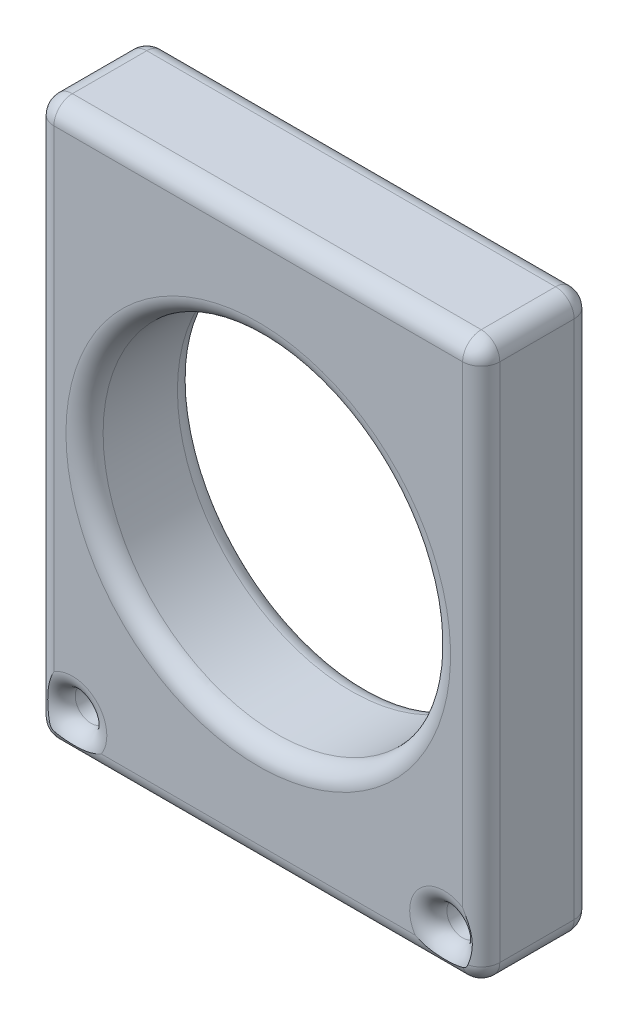
from build123d import *

# Parameters (mm, degrees)
SKETCH_1_W      = 48
SKETCH_1_H      = 60
SKETCH_1_R      = 18.7
SKETCH_1_R_2    = 1.7
EXTRUDE_1_DEPTH = 6
FILLET_1_R      = 2


with BuildPart() as part:
    # 草图1 → 凸台-拉伸1 (new, symmetric)
    with BuildSketch(Plane.XY):
        with Locations((0, 6)):
            Rectangle(SKETCH_1_W, SKETCH_1_H)
        with Locations((0, 6)):
            Circle(SKETCH_1_R, mode=Mode.SUBTRACT)
        with Locations((20, -20)):
            Circle(SKETCH_1_R_2, mode=Mode.SUBTRACT)
        with Locations((-20, -20)):
            Circle(SKETCH_1_R_2, mode=Mode.SUBTRACT)
    extrude(amount=EXTRUDE_1_DEPTH, both=True)

    # 圆角1
    # the kernel refuses this fillet: 2 mm, written as the material it takes off along each edge
    with BuildSketch(Plane(origin=(-22, 34, 4), x_dir=(0, 1, 0), z_dir=(-1, 0, 0))) as fillet_1_piece_1_section:
        Polygon((0, 0), (FILLET_1_R, 0), (FILLET_1_R, -FILLET_1_R), (0, -FILLET_1_R), align=None)
    fillet_1_piece_1 = extrude(amount=FILLET_1_R, mode=Mode.PRIVATE)
    fillet_1_piece_1 = fillet_1_piece_1 - Plane(origin=(-22, 34, 4), x_dir=(0, -0.7071067811865475, -0.7071067811865475), z_dir=(-1, 0, 0)) * Sphere(FILLET_1_R, mode=Mode.PRIVATE)
    add(fillet_1_piece_1, mode=Mode.SUBTRACT)
    with BuildSketch(Plane(origin=(-22, -22, 4), x_dir=(-1, 0, 0), z_dir=(0, -1, 0))) as fillet_1_piece_2_section:
        Polygon((0, 0), (FILLET_1_R, 0), (FILLET_1_R, -FILLET_1_R), (0, -FILLET_1_R), align=None)
    fillet_1_piece_2 = extrude(amount=FILLET_1_R, mode=Mode.PRIVATE)
    fillet_1_piece_2 = fillet_1_piece_2 - Plane(origin=(-22, -22, 4), x_dir=(0.7071067811865475, 0, -0.7071067811865475), z_dir=(0, -1, 0)) * Sphere(FILLET_1_R, mode=Mode.PRIVATE)
    add(fillet_1_piece_2, mode=Mode.SUBTRACT)
    with BuildSketch(Plane(origin=(22, -22, 4), x_dir=(0, 0, 1), z_dir=(0, -1, 0))) as fillet_1_piece_3_section:
        Polygon((0, 0), (FILLET_1_R, 0), (FILLET_1_R, -FILLET_1_R), (0, -FILLET_1_R), align=None)
    fillet_1_piece_3 = extrude(amount=FILLET_1_R, mode=Mode.PRIVATE)
    fillet_1_piece_3 = fillet_1_piece_3 - Plane(origin=(22, -22, 4), x_dir=(-0.7071067811865475, 0, -0.7071067811865475), z_dir=(0, -1, 0)) * Sphere(FILLET_1_R, mode=Mode.PRIVATE)
    add(fillet_1_piece_3, mode=Mode.SUBTRACT)
    with BuildSketch(Plane(origin=(22, 34, 4), x_dir=(0, 0, 1), z_dir=(0, 1, 0))) as fillet_1_piece_4_section:
        Polygon((0, 0), (FILLET_1_R, 0), (FILLET_1_R, FILLET_1_R), (0, FILLET_1_R), align=None)
    fillet_1_piece_4 = extrude(amount=FILLET_1_R, mode=Mode.PRIVATE)
    fillet_1_piece_4 = fillet_1_piece_4 - Plane(origin=(22, 34, 4), x_dir=(-0.7071067811865475, 0, -0.7071067811865475), z_dir=(0, 1, 0)) * Sphere(FILLET_1_R, mode=Mode.PRIVATE)
    add(fillet_1_piece_4, mode=Mode.SUBTRACT)
    with BuildSketch(Plane(origin=(-22, -22, -4), x_dir=(0, 0, -1), z_dir=(0, -1, 0))) as fillet_1_piece_5_section:
        Polygon((0, 0), (FILLET_1_R, 0), (FILLET_1_R, -FILLET_1_R), (0, -FILLET_1_R), align=None)
    fillet_1_piece_5 = extrude(amount=FILLET_1_R, mode=Mode.PRIVATE)
    fillet_1_piece_5 = fillet_1_piece_5 - Plane(origin=(-22, -22, -4), x_dir=(0.7071067811865475, 0, 0.7071067811865475), z_dir=(0, -1, 0)) * Sphere(FILLET_1_R, mode=Mode.PRIVATE)
    add(fillet_1_piece_5, mode=Mode.SUBTRACT)
    with BuildSketch(Plane(origin=(22, -22, -4), x_dir=(0, 0, -1), z_dir=(0, -1, 0))) as fillet_1_piece_6_section:
        Polygon((0, 0), (FILLET_1_R, 0), (FILLET_1_R, FILLET_1_R), (0, FILLET_1_R), align=None)
    fillet_1_piece_6 = extrude(amount=FILLET_1_R, mode=Mode.PRIVATE)
    fillet_1_piece_6 = fillet_1_piece_6 - Plane(origin=(22, -22, -4), x_dir=(-0.7071067811865475, 0, 0.7071067811865475), z_dir=(0, -1, 0)) * Sphere(FILLET_1_R, mode=Mode.PRIVATE)
    add(fillet_1_piece_6, mode=Mode.SUBTRACT)
    with BuildSketch(Plane(origin=(-22, 34, -4), x_dir=(-1, 0, 0), z_dir=(0, 0, -1))) as fillet_1_piece_7_section:
        Polygon((0, 0), (FILLET_1_R, 0), (FILLET_1_R, FILLET_1_R), (0, FILLET_1_R), align=None)
    fillet_1_piece_7 = extrude(amount=FILLET_1_R, mode=Mode.PRIVATE)
    fillet_1_piece_7 = fillet_1_piece_7 - Plane(origin=(-22, 34, -4), x_dir=(0.7071067811865475, -0.7071067811865475, 0), z_dir=(0, 0, -1)) * Sphere(FILLET_1_R, mode=Mode.PRIVATE)
    add(fillet_1_piece_7, mode=Mode.SUBTRACT)
    with BuildSketch(Plane(origin=(22, 34, -4), x_dir=(0, 1, 0), z_dir=(0, 0, -1))) as fillet_1_piece_8_section:
        Polygon((0, 0), (FILLET_1_R, 0), (FILLET_1_R, FILLET_1_R), (0, FILLET_1_R), align=None)
    fillet_1_piece_8 = extrude(amount=FILLET_1_R, mode=Mode.PRIVATE)
    fillet_1_piece_8 = fillet_1_piece_8 - Plane(origin=(22, 34, -4), x_dir=(-0.7071067811865475, -0.7071067811865475, 0), z_dir=(0, 0, -1)) * Sphere(FILLET_1_R, mode=Mode.PRIVATE)
    add(fillet_1_piece_8, mode=Mode.SUBTRACT)
    with BuildSketch(Plane(origin=(0, 6, -6), x_dir=(1, 0, 0), z_dir=(0, -1, 0))) as fillet_1_piece_9:
        with BuildLine():
            CenterArc((18.7 + FILLET_1_R, FILLET_1_R), FILLET_1_R, 180, 90)
            Line((18.7 + FILLET_1_R, 0), (18.7, 0))
            Line((18.7, 0), (18.7, FILLET_1_R))
        make_face()
    revolve(axis=Axis((0, 6, -6), (0, 0, 1)), mode=Mode.SUBTRACT)
    with BuildSketch(Plane(origin=(0, 6, 6), x_dir=(1, 0, 0), z_dir=(0, -1, 0))) as fillet_1_piece_10:
        with BuildLine():
            CenterArc((18.7 + FILLET_1_R, -FILLET_1_R), FILLET_1_R, 90, 90)
            Line((18.7, -FILLET_1_R), (18.7, 0))
            Line((18.7, 0), (18.7 + FILLET_1_R, 0))
        make_face()
    revolve(axis=Axis((0, 6, 6), (0, 0, 1)), mode=Mode.SUBTRACT)
    with BuildSketch(Plane(origin=(-24, 34, 6), x_dir=(0, 0, -1), z_dir=(0, -1, 0))) as fillet_1_piece_11:
        with BuildLine():
            CenterArc((FILLET_1_R, FILLET_1_R), FILLET_1_R, 180, 90)
            Line((0, FILLET_1_R), (0, 0))
            Line((0, 0), (FILLET_1_R, 0))
        make_face()
    extrude(amount=56, mode=Mode.SUBTRACT)
    with BuildSketch(Plane(origin=(20, -20, -6), x_dir=(1, 0, 0), z_dir=(0, -1, 0))) as fillet_1_piece_12:
        with BuildLine():
            CenterArc((1.7 + FILLET_1_R, FILLET_1_R), FILLET_1_R, 180, 90)
            Line((1.7 + FILLET_1_R, 0), (1.7, 0))
            Line((1.7, 0), (1.7, FILLET_1_R))
        make_face()
    revolve(axis=Axis((20, -20, -6), (0, 0, 1)), mode=Mode.SUBTRACT)
    with BuildSketch(Plane(origin=(20, -20, 6), x_dir=(1, 0, 0), z_dir=(0, -1, 0))) as fillet_1_piece_13:
        with BuildLine():
            CenterArc((1.7 + FILLET_1_R, -FILLET_1_R), FILLET_1_R, 90, 90)
            Line((1.7, -FILLET_1_R), (1.7, 0))
            Line((1.7, 0), (1.7 + FILLET_1_R, 0))
        make_face()
    revolve(axis=Axis((20, -20, 6), (0, 0, 1)), mode=Mode.SUBTRACT)
    with BuildSketch(Plane(origin=(-22, -24, 6), x_dir=(0, 0, -1), z_dir=(1, 0, 0)), Plane(origin=(22, 36, 6), x_dir=(0, 0, -1), z_dir=(-1, 0, 0))) as fillet_1_piece_14:
        with BuildLine():
            CenterArc((FILLET_1_R, FILLET_1_R), FILLET_1_R, 180, 90)
            Line((0, FILLET_1_R), (0, 0))
            Line((0, 0), (FILLET_1_R, 0))
        make_face()
    extrude(amount=44, mode=Mode.SUBTRACT)
    with BuildSketch(Plane(origin=(-20, -20, -6), x_dir=(1, 0, 0), z_dir=(0, -1, 0))) as fillet_1_piece_15:
        with BuildLine():
            CenterArc((1.7 + FILLET_1_R, FILLET_1_R), FILLET_1_R, 180, 90)
            Line((1.7 + FILLET_1_R, 0), (1.7, 0))
            Line((1.7, 0), (1.7, FILLET_1_R))
        make_face()
    revolve(axis=Axis((-20, -20, -6), (0, 0, 1)), mode=Mode.SUBTRACT)
    with BuildSketch(Plane(origin=(-20, -20, 6), x_dir=(1, 0, 0), z_dir=(0, -1, 0))) as fillet_1_piece_16:
        with BuildLine():
            CenterArc((1.7 + FILLET_1_R, -FILLET_1_R), FILLET_1_R, 90, 90)
            Line((1.7, -FILLET_1_R), (1.7, 0))
            Line((1.7, 0), (1.7 + FILLET_1_R, 0))
        make_face()
    revolve(axis=Axis((-20, -20, 6), (0, 0, 1)), mode=Mode.SUBTRACT)
    with BuildSketch(Plane(origin=(24, -22, 6), x_dir=(-1, 0, 0), z_dir=(0, 1, 0)), Plane(origin=(-24, 34, -6), x_dir=(0, 0, 1), z_dir=(0, -1, 0)), Plane(origin=(24, -22, -6), x_dir=(0, 0, 1), z_dir=(0, 1, 0))) as fillet_1_piece_17:
        with BuildLine():
            CenterArc((FILLET_1_R, -FILLET_1_R), FILLET_1_R, 90, 90)
            Line((0, -FILLET_1_R), (0, 0))
            Line((0, 0), (FILLET_1_R, 0))
        make_face()
    extrude(amount=56, mode=Mode.SUBTRACT)
    with BuildSketch(Plane(origin=(-22, -24, -6), x_dir=(0, 0, 1), z_dir=(1, 0, 0)), Plane(origin=(22, 36, -6), x_dir=(0, 0, 1), z_dir=(-1, 0, 0))) as fillet_1_piece_18:
        with BuildLine():
            CenterArc((FILLET_1_R, -FILLET_1_R), FILLET_1_R, 90, 90)
            Line((0, -FILLET_1_R), (0, 0))
            Line((0, 0), (FILLET_1_R, 0))
        make_face()
    extrude(amount=44, mode=Mode.SUBTRACT)
    with BuildSketch(Plane(origin=(24, -24, -4), x_dir=(-1, 0, 0), z_dir=(0, 0, 1)), Plane(origin=(-24, -24, 4), x_dir=(1, 0, 0), z_dir=(0, 0, -1)), Plane(origin=(-24, 36, 4), x_dir=(0, -1, 0), z_dir=(0, 0, -1))) as fillet_1_piece_19:
        with BuildLine():
            CenterArc((FILLET_1_R, -FILLET_1_R), FILLET_1_R, 90, 90)
            Line((0, -FILLET_1_R), (0, 0))
            Line((0, 0), (FILLET_1_R, 0))
        make_face()
    extrude(amount=8, mode=Mode.SUBTRACT)
    with BuildSketch(Plane(origin=(24, 36, -4), x_dir=(-1, 0, 0), z_dir=(0, 0, 1))) as fillet_1_piece_20:
        with BuildLine():
            CenterArc((FILLET_1_R, FILLET_1_R), FILLET_1_R, 180, 90)
            Line((0, FILLET_1_R), (0, 0))
            Line((0, 0), (FILLET_1_R, 0))
        make_face()
    extrude(amount=8, mode=Mode.SUBTRACT)


solid = part.part
